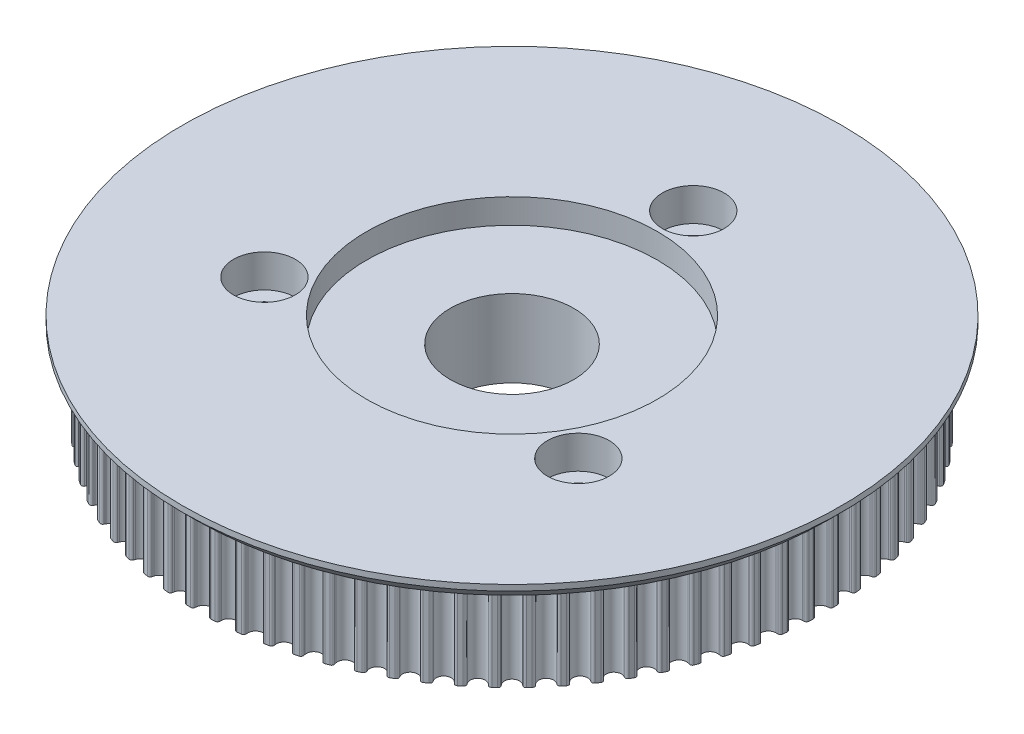
from build123d import *

# Parameters (mm, degrees)
SKETCH1_R           = 37.815
BOSS_EXTRUDE1_DEPTH = 10.2
CUT_EXTRUDE1_DEPTH  = 10.2
CIRPATTERN1_COUNT   = 80
SKETCH4_R           = 40
BOSS_EXTRUDE2_DEPTH = 2.2
SKETCH5_R           = 7.5
CUT_EXTRUDE2_DEPTH  = 58.911656858
CHAMFER1_SIZE       = 1.5
SKETCH6_R           = 2
CUT_EXTRUDE3_DEPTH  = 58.911656858
SKETCH7_R           = 3.75
CUT_EXTRUDE4_DEPTH  = 4
SKETCH8_R           = 17.65
CUT_EXTRUDE5_DEPTH  = 3


with BuildPart() as part:
    # Sketch1 → Boss-Extrude1 (new body)
    with BuildSketch(Plane(origin=(0, 0, 0), x_dir=(1, 0, 0), z_dir=(0, 1, 0))):
        Circle(SKETCH1_R)
    extrude(amount=BOSS_EXTRUDE1_DEPTH)

    # Sketch2 → Cut-Extrude1 (cut)
    with BuildSketch(Plane.XZ):
        with BuildLine():
            Line((-0.927460675, 37.5315478), (-0.903216998, 37.334098898))
            ThreePointArc((-0.903216998, 37.334098898), (0, 36.535), (0.903216998, 37.334098898))
            Line((0.903216998, 37.334098898), (0.927460675, 37.5315478))
            ThreePointArc((0.927460675, 37.5315478), (1.030134596, 37.722890313), (1.235022397, 37.794826957))
            ThreePointArc((1.235022397, 37.794826957), (1.359823579, 37.790542532), (1.484609933, 37.785846005))
            Line((1.484609933, 37.785846005), (0, 42.815))
            Line((0, 42.815), (-1.484609933, 37.785846005))
            ThreePointArc((-1.484609933, 37.785846005), (-1.359823579, 37.790542532), (-1.235022397, 37.794826957))
            ThreePointArc((-1.235022397, 37.794826957), (-1.030134596, 37.722890313), (-0.927460675, 37.5315478))
        make_face()
    cut_extrude1 = extrude(amount=-CUT_EXTRUDE1_DEPTH, mode=Mode.SUBTRACT)

    # CirPattern1: Cut-Extrude1 ×80 about axis
    cirpattern1_axis = Axis((0, 0, 0), (0, 1, 0))
    for i in range(1, CIRPATTERN1_COUNT):
        add(cut_extrude1.rotate(cirpattern1_axis, i * 360 / CIRPATTERN1_COUNT), mode=Mode.SUBTRACT)

    # Sketch4 → Boss-Extrude2 (add)
    with BuildSketch(Plane(origin=(0, 10.2, 0), x_dir=(1, 0, 0), z_dir=(0, 1, 0))):
        Circle(SKETCH4_R)
    extrude(amount=BOSS_EXTRUDE2_DEPTH)

    # Sketch5 → Cut-Extrude2 (cut, through all)
    with BuildSketch(Plane(origin=(0, 12.4, 0), x_dir=(1, 0, 0), z_dir=(0, 1, 0))):
        Circle(SKETCH5_R)
    extrude(amount=-CUT_EXTRUDE2_DEPTH, mode=Mode.SUBTRACT)

    # Chamfer1
    chamfer1_edges = [part.edges().sort_by_distance(p)[0] for p in [
        (-40, 10.2, 0),
    ]]
    chamfer(chamfer1_edges, length=CHAMFER1_SIZE)

    # Sketch6 → Cut-Extrude3 (cut, through all)
    with BuildSketch(Plane(origin=(0, 12.4, 0), x_dir=(1, 0, 0), z_dir=(0, 1, 0))):
        with Locations((0, 22)):
            Circle(SKETCH6_R)
        with Locations((19.052558883, -11)):
            Circle(SKETCH6_R)
        with Locations((-19.052558883, -11)):
            Circle(SKETCH6_R)
    extrude(amount=-CUT_EXTRUDE3_DEPTH, mode=Mode.SUBTRACT)

    # Sketch7 → Cut-Extrude4 (cut)
    with BuildSketch(Plane(origin=(0, 12.4, 0), x_dir=(1, 0, 0), z_dir=(0, 1, 0))):
        with Locations((0, 22)):
            Circle(SKETCH7_R)
        with Locations((19.052558883, -11)):
            Circle(SKETCH7_R)
        with Locations((-19.052558883, -11)):
            Circle(SKETCH7_R)
    extrude(amount=-CUT_EXTRUDE4_DEPTH, mode=Mode.SUBTRACT)

    # Sketch8 → Cut-Extrude5 (cut)
    with BuildSketch(Plane(origin=(0, 12.4, 0), x_dir=(1, 0, 0), z_dir=(0, 1, 0))):
        Circle(SKETCH8_R)
    extrude(amount=-CUT_EXTRUDE5_DEPTH, mode=Mode.SUBTRACT)


solid = part.part
